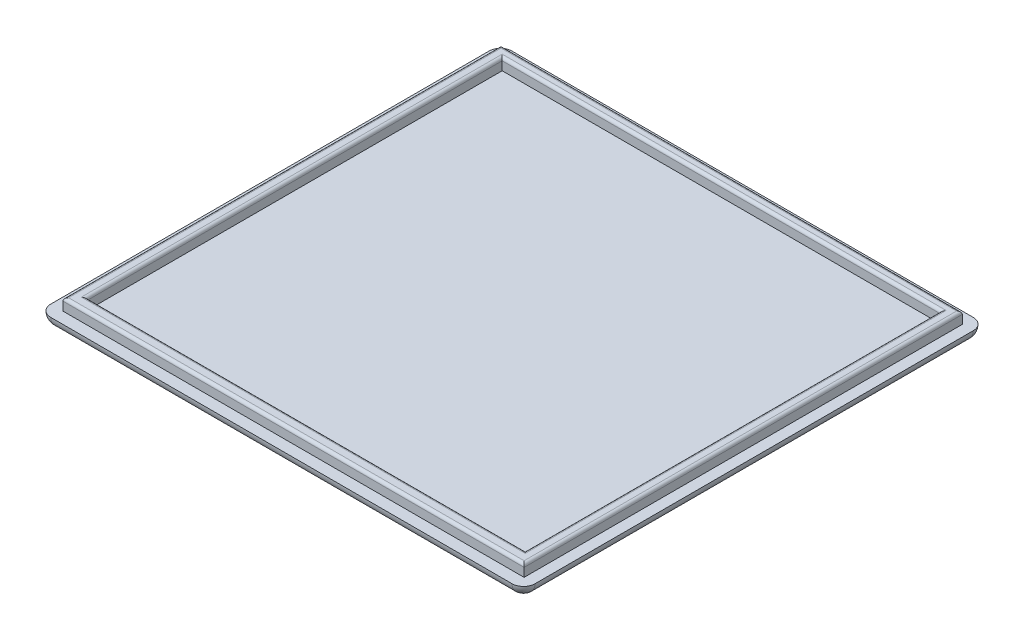
from build123d import *

# Parameters (mm, degrees)
SKETCH1_W           = 84
SKETCH1_H           = 80
BOSS_EXTRUDE1_DEPTH = 2
SKETCH3_W           = 80
SKETCH3_H           = 76
SKETCH3_W_2         = 76
SKETCH3_H_2         = 72
BOSS_EXTRUDE2_DEPTH = 2
FILLET1_R           = 2
FILLET2_R           = 2
FILLET3_R           = 0.5


with BuildPart() as part:
    # Sketch1 → Boss-Extrude1 (new body)
    with BuildSketch(Plane(origin=(0, 0, 0), x_dir=(1, 0, 0), z_dir=(0, 1, 0))):
        with Locations((42, 40)):
            Rectangle(SKETCH1_W, SKETCH1_H)
    extrude(amount=BOSS_EXTRUDE1_DEPTH)

    # Sketch3 → Boss-Extrude2 (add)
    with BuildSketch(Plane(origin=(0, 2, 0), x_dir=(1, 0, 0), z_dir=(0, 1, 0))):
        with Locations((42.1, 40)):
            Rectangle(SKETCH3_W, SKETCH3_H)
        with Locations((42.106134664, 40.19047619)):
            Rectangle(SKETCH3_W_2, SKETCH3_H_2, mode=Mode.SUBTRACT)
    extrude(amount=BOSS_EXTRUDE2_DEPTH)

    # Fillet1
    fillet1_edges = [part.edges().sort_by_distance(p)[0] for p in [
        (0, 1, -80),
        (84, 1, -80),
        (84, 1, 0),
        (0, 1, 0),
    ]]
    fillet(fillet1_edges, radius=FILLET1_R)

    # Fillet2
    fillet2_edges = [part.edges().sort_by_distance(p)[0] for p in [
        (0.585786438, 0, -0.585786438),
        (0.585786438, 0, -79.414213562),
        (83.414213562, 0, -79.414213562),
        (83.414213562, 0, -0.585786438),
        (84, 0, -40),
        (42, 0, -80),
        (0, 0, -40),
        (42, 0, 0),
    ]]
    fillet(fillet2_edges, radius=FILLET2_R - 0.0001)  # a hair under: the kernel refuses the full size

    # Fillet3
    fillet3_edges = [part.edges().sort_by_distance(p)[0] for p in [
        (42.1, 4, -2),
        (82.1, 4, -40),
        (42.1, 4, -78),
        (2.1, 4, -40),
        (42.106134664, 4, -4.19047619),
        (80.106134664, 4, -40.19047619),
        (42.106134664, 4, -76.19047619),
        (4.106134664, 4, -40.19047619),
    ]]
    fillet(fillet3_edges, radius=FILLET3_R)


solid = part.part
